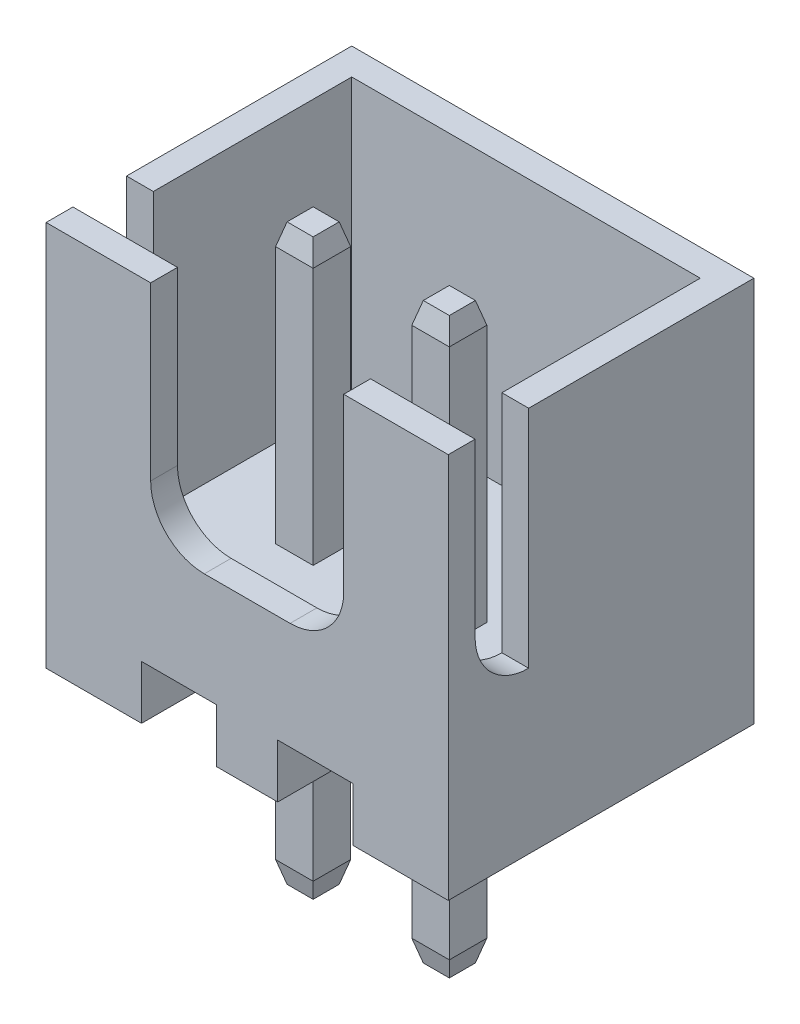
from build123d import *
from OCP.BRepFilletAPI import BRepFilletAPI_MakeChamfer

# Parameters (mm, degrees)
CROQUIS2_W              = 7.5
CROQUIS2_H              = 5.7
SALIENTE_EXTRUIR1_DEPTH = 7.2
CROQUIS3_W              = 6.5
CROQUIS3_H              = 4.7
CORTAR_EXTRUIR1_DEPTH   = 5.2
CROQUIS4_W              = 3.6
CROQUIS4_H              = 0.5
CORTAR_EXTRUIR2_DEPTH   = 4.2
CROQUIS5_W              = 1
CROQUIS5_H              = 4.2
CORTAR_EXTRUIR3_DEPTH   = 11.780190165
REDONDEO1_R             = 1
CROQUIS7_W              = 1.4
CROQUIS7_H              = 5.7
CORTAR_EXTRUIR4_DEPTH   = 1
SALIENTE_EXTRUIR2_START = -7.2
CROQUIS6_W              = 0.7
CROQUIS6_H              = 0.7
SALIENTE_EXTRUIR2_DEPTH = 10.7
CHAFL_N1_SIZE           = 0.4
CHAFL_N1_SIZE2          = 0.107179677
CHAFL_N2_SIZE           = 0.4
CHAFL_N2_SIZE2          = 0.107179677
CHAFL_N3_SIZE           = 0.4
CHAFL_N3_SIZE2          = 0.107179677


with BuildPart() as part:
    # Croquis2 → Saliente-Extruir1 (new body)
    with BuildSketch(Plane(origin=(0, 0, 0), x_dir=(1, 0, 0), z_dir=(0, 1, 0))):
        Rectangle(CROQUIS2_W, CROQUIS2_H)
    extrude(amount=SALIENTE_EXTRUIR1_DEPTH)

    # Croquis3 → Cortar-Extruir1 (cut)
    with BuildSketch(Plane(origin=(0, 7.2, 0), x_dir=(1, 0, 0), z_dir=(0, 1, 0))):
        Rectangle(CROQUIS3_W, CROQUIS3_H)
    extrude(amount=-CORTAR_EXTRUIR1_DEPTH, mode=Mode.SUBTRACT)

    # Croquis4 → Cortar-Extruir2 (cut)
    with BuildSketch(Plane(origin=(0, 7.2, 0), x_dir=(1, 0, 0), z_dir=(0, 1, 0))):
        with Locations((0, -2.6)):
            Rectangle(CROQUIS4_W, CROQUIS4_H)
    extrude(amount=-CORTAR_EXTRUIR2_DEPTH, mode=Mode.SUBTRACT)

    # Croquis5 → Cortar-Extruir3 (cut, through all)
    with BuildSketch(Plane(origin=(3.75, 0, 0), x_dir=(0, 0, -1), z_dir=(1, 0, 0))):
        with Locations((-1.85, 5.1)):
            Rectangle(CROQUIS5_W, CROQUIS5_H)
    extrude(amount=-CORTAR_EXTRUIR3_DEPTH, mode=Mode.SUBTRACT)

    # Redondeo1
    # the kernel refuses this fillet: 1 mm, written as the material it adds along each edge
    with BuildSketch(Plane(origin=(1.8, 3, 2.85), x_dir=(0, 1, 0), z_dir=(0, 0, -1)), Plane(origin=(3.75, 3, 2.35), x_dir=(0, 0, -1), z_dir=(-1, 0, 0))) as redondeo1_piece_1:
        with BuildLine():
            CenterArc((REDONDEO1_R, -REDONDEO1_R), REDONDEO1_R, 90, 90)
            Line((0, -REDONDEO1_R), (0, 0))
            Line((0, 0), (REDONDEO1_R, 0))
        make_face()
    extrude(amount=0.5)
    with BuildSketch(Plane(origin=(-1.8, 3, 2.35), x_dir=(1, 0, 0), z_dir=(0, 0, 1)), Plane(origin=(-3.25, 3, 2.35), x_dir=(0, 1, 0), z_dir=(-1, 0, 0))) as redondeo1_piece_2:
        with BuildLine():
            CenterArc((REDONDEO1_R, REDONDEO1_R), REDONDEO1_R, 180, 90)
            Line((0, REDONDEO1_R), (0, 0))
            Line((0, 0), (REDONDEO1_R, 0))
        make_face()
    extrude(amount=0.5)

    # Croquis7 → Cortar-Extruir4 (cut)
    with BuildSketch(Plane.XZ):
        with Locations((-1.27, 0)):
            Rectangle(CROQUIS7_W, CROQUIS7_H)
        with Locations((1.27, 0)):
            Rectangle(CROQUIS7_W, CROQUIS7_H)
    extrude(amount=-CORTAR_EXTRUIR4_DEPTH, mode=Mode.SUBTRACT)

    # Croquis6 → Saliente-Extruir2 (add)
    with BuildSketch(Plane.XZ.offset(SALIENTE_EXTRUIR2_START)):
        with Locations((-1.27, 0.35)):
            Rectangle(CROQUIS6_W, CROQUIS6_H)
        with Locations((1.27, 0.35)):
            Rectangle(CROQUIS6_W, CROQUIS6_H)
    extrude(amount=SALIENTE_EXTRUIR2_DEPTH)

    # Chaflán1: one chamfer whose edges measure the first distance from different faces: ONE call of the kernel's chamfer builder (chamfer() names one face for all edges)
    chafl_n1_edges_1 = [part.edges().sort_by_distance(p)[0] for p in [
        (-0.92, -3.5, 0.35),
    ]]
    chafl_n1_side_1 = [part.faces().sort_by_distance(p)[0] for p in [
        (-0.92, -1.25, 0.35),
    ]]
    chafl_n1_edges_2 = [part.edges().sort_by_distance(p)[0] for p in [
        (-1.27, -3.5, 0.7),
    ]]
    chafl_n1_side_2 = [part.faces().sort_by_distance(p)[0] for p in [
        (-1.27, -1.25, 0.7),
    ]]
    chafl_n1_edges_3 = [part.edges().sort_by_distance(p)[0] for p in [
        (-1.62, -3.5, 0.35),
    ]]
    chafl_n1_side_3 = [part.faces().sort_by_distance(p)[0] for p in [
        (-1.62, -1.25, 0.35),
    ]]
    chafl_n1_edges_4 = [part.edges().sort_by_distance(p)[0] for p in [
        (-1.27, -3.5, 0),
    ]]
    chafl_n1_side_4 = [part.faces().sort_by_distance(p)[0] for p in [
        (-1.27, -1.25, 0),
    ]]
    chafl_n1_edges_5 = [part.edges().sort_by_distance(p)[0] for p in [
        (1.62, -3.5, 0.35),
    ]]
    chafl_n1_side_5 = [part.faces().sort_by_distance(p)[0] for p in [
        (1.62, -1.25, 0.35),
    ]]
    chafl_n1_edges_6 = [part.edges().sort_by_distance(p)[0] for p in [
        (1.27, -3.5, 0.7),
    ]]
    chafl_n1_side_6 = [part.faces().sort_by_distance(p)[0] for p in [
        (1.27, -1.25, 0.7),
    ]]
    chafl_n1_edges_7 = [part.edges().sort_by_distance(p)[0] for p in [
        (0.92, -3.5, 0.35),
    ]]
    chafl_n1_side_7 = [part.faces().sort_by_distance(p)[0] for p in [
        (0.92, -1.25, 0.35),
    ]]
    chafl_n1_edges_8 = [part.edges().sort_by_distance(p)[0] for p in [
        (1.27, -3.5, 0),
    ]]
    chafl_n1_side_8 = [part.faces().sort_by_distance(p)[0] for p in [
        (1.27, -1.25, 0),
    ]]
    chafl_n1 = BRepFilletAPI_MakeChamfer(part.part.solid().wrapped)
    for e in chafl_n1_edges_1:
        chafl_n1.Add(CHAFL_N1_SIZE, CHAFL_N1_SIZE2, e.wrapped, chafl_n1_side_1[0].wrapped)  # the first distance lies on this face
    for e in chafl_n1_edges_2:
        chafl_n1.Add(CHAFL_N1_SIZE, CHAFL_N1_SIZE2, e.wrapped, chafl_n1_side_2[0].wrapped)  # the first distance lies on this face
    for e in chafl_n1_edges_3:
        chafl_n1.Add(CHAFL_N1_SIZE, CHAFL_N1_SIZE2, e.wrapped, chafl_n1_side_3[0].wrapped)  # the first distance lies on this face
    for e in chafl_n1_edges_4:
        chafl_n1.Add(CHAFL_N1_SIZE, CHAFL_N1_SIZE2, e.wrapped, chafl_n1_side_4[0].wrapped)  # the first distance lies on this face
    for e in chafl_n1_edges_5:
        chafl_n1.Add(CHAFL_N1_SIZE, CHAFL_N1_SIZE2, e.wrapped, chafl_n1_side_5[0].wrapped)  # the first distance lies on this face
    for e in chafl_n1_edges_6:
        chafl_n1.Add(CHAFL_N1_SIZE, CHAFL_N1_SIZE2, e.wrapped, chafl_n1_side_6[0].wrapped)  # the first distance lies on this face
    for e in chafl_n1_edges_7:
        chafl_n1.Add(CHAFL_N1_SIZE, CHAFL_N1_SIZE2, e.wrapped, chafl_n1_side_7[0].wrapped)  # the first distance lies on this face
    for e in chafl_n1_edges_8:
        chafl_n1.Add(CHAFL_N1_SIZE, CHAFL_N1_SIZE2, e.wrapped, chafl_n1_side_8[0].wrapped)  # the first distance lies on this face
    add(Compound.cast(chafl_n1.Shape()), mode=Mode.REPLACE)

    # Chaflán2: one chamfer whose edges measure the first distance from different faces: ONE call of the kernel's chamfer builder (chamfer() names one face for all edges)
    chafl_n2_edges_1 = [part.edges().sort_by_distance(p)[0] for p in [
        (-1.27, 7.2, 0.7),
    ]]
    chafl_n2_side_1 = [part.faces().sort_by_distance(p)[0] for p in [
        (-1.27, 4.6, 0.7),
    ]]
    chafl_n2_edges_2 = [part.edges().sort_by_distance(p)[0] for p in [
        (-1.62, 7.2, 0.35),
    ]]
    chafl_n2_side_2 = [part.faces().sort_by_distance(p)[0] for p in [
        (-1.62, 4.6, 0.35),
    ]]
    chafl_n2_edges_3 = [part.edges().sort_by_distance(p)[0] for p in [
        (-1.27, 7.2, 0),
    ]]
    chafl_n2_side_3 = [part.faces().sort_by_distance(p)[0] for p in [
        (-1.27, 4.6, 0),
    ]]
    chafl_n2_edges_4 = [part.edges().sort_by_distance(p)[0] for p in [
        (-0.92, 7.2, 0.35),
    ]]
    chafl_n2_side_4 = [part.faces().sort_by_distance(p)[0] for p in [
        (-0.92, 4.6, 0.35),
    ]]
    chafl_n2 = BRepFilletAPI_MakeChamfer(part.part.solid().wrapped)
    for e in chafl_n2_edges_1:
        chafl_n2.Add(CHAFL_N2_SIZE, CHAFL_N2_SIZE2, e.wrapped, chafl_n2_side_1[0].wrapped)  # the first distance lies on this face
    for e in chafl_n2_edges_2:
        chafl_n2.Add(CHAFL_N2_SIZE, CHAFL_N2_SIZE2, e.wrapped, chafl_n2_side_2[0].wrapped)  # the first distance lies on this face
    for e in chafl_n2_edges_3:
        chafl_n2.Add(CHAFL_N2_SIZE, CHAFL_N2_SIZE2, e.wrapped, chafl_n2_side_3[0].wrapped)  # the first distance lies on this face
    for e in chafl_n2_edges_4:
        chafl_n2.Add(CHAFL_N2_SIZE, CHAFL_N2_SIZE2, e.wrapped, chafl_n2_side_4[0].wrapped)  # the first distance lies on this face
    add(Compound.cast(chafl_n2.Shape()), mode=Mode.REPLACE)

    # Chaflán3: one chamfer whose edges measure the first distance from different faces: ONE call of the kernel's chamfer builder (chamfer() names one face for all edges)
    chafl_n3_edges_1 = [part.edges().sort_by_distance(p)[0] for p in [
        (1.27, 7.2, 0.7),
    ]]
    chafl_n3_side_1 = [part.faces().sort_by_distance(p)[0] for p in [
        (1.27, 4.6, 0.7),
    ]]
    chafl_n3_edges_2 = [part.edges().sort_by_distance(p)[0] for p in [
        (0.92, 7.2, 0.35),
    ]]
    chafl_n3_side_2 = [part.faces().sort_by_distance(p)[0] for p in [
        (0.92, 4.6, 0.35),
    ]]
    chafl_n3_edges_3 = [part.edges().sort_by_distance(p)[0] for p in [
        (1.27, 7.2, 0),
    ]]
    chafl_n3_side_3 = [part.faces().sort_by_distance(p)[0] for p in [
        (1.27, 4.6, 0),
    ]]
    chafl_n3_edges_4 = [part.edges().sort_by_distance(p)[0] for p in [
        (1.62, 7.2, 0.35),
    ]]
    chafl_n3_side_4 = [part.faces().sort_by_distance(p)[0] for p in [
        (1.62, 4.6, 0.35),
    ]]
    chafl_n3 = BRepFilletAPI_MakeChamfer(part.part.solid().wrapped)
    for e in chafl_n3_edges_1:
        chafl_n3.Add(CHAFL_N3_SIZE, CHAFL_N3_SIZE2, e.wrapped, chafl_n3_side_1[0].wrapped)  # the first distance lies on this face
    for e in chafl_n3_edges_2:
        chafl_n3.Add(CHAFL_N3_SIZE, CHAFL_N3_SIZE2, e.wrapped, chafl_n3_side_2[0].wrapped)  # the first distance lies on this face
    for e in chafl_n3_edges_3:
        chafl_n3.Add(CHAFL_N3_SIZE, CHAFL_N3_SIZE2, e.wrapped, chafl_n3_side_3[0].wrapped)  # the first distance lies on this face
    for e in chafl_n3_edges_4:
        chafl_n3.Add(CHAFL_N3_SIZE, CHAFL_N3_SIZE2, e.wrapped, chafl_n3_side_4[0].wrapped)  # the first distance lies on this face
    add(Compound.cast(chafl_n3.Shape()), mode=Mode.REPLACE)


solid = part.part
